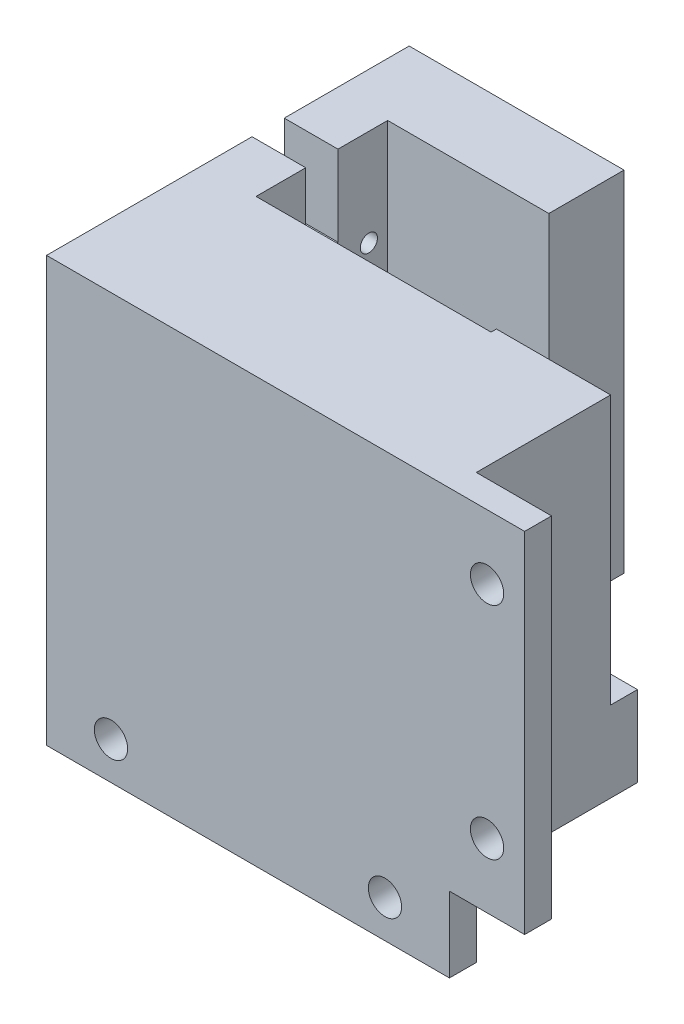
from build123d import *
from build123d.topology import SkipClean

# Parameters (mm, degrees)
BOSS_EXTRUDE1_DEPTH      = 42.5
BOSS_EXTRUDE1_DEPTH_BACK = 15
SKETCH1_W                = 40
SKETCH1_H                = 65
SKETCH3_W                = 22.5
SKETCH3_H                = 50
CUT_EXTRUDE2_DEPTH       = 30
SKETCH4_R                = 4.5
CUT_EXTRUDE3_DEPTH       = 10
SKETCH5_W                = 35
SKETCH5_H                = 25
BOSS_EXTRUDE3_DEPTH      = 15
SKETCH6_R                = 3
CUT_EXTRUDE4_DEPTH       = 30
CUT_EXTRUDE5_DEPTH       = 108.964114408
BOSS_EXTRUDE4_DEPTH      = 10
BOSS_EXTRUDE5_OUTLINE_R  = 3
BOSS_EXTRUDE5_DEPTH      = 50
BOSS_EXTRUDE6_START      = -35
SKETCH11_R               = 3
BOSS_EXTRUDE6_DEPTH      = 35
SKETCH12_W               = 14
SKETCH12_H               = 65
SKETCH12_R               = 3.1
SKETCH12_W_2             = 75
SKETCH12_H_2             = 14
BOSS_EXTRUDE7_DEPTH      = 5
SKETCH13_R               = 1.6
CUT_EXTRUDE6_DEPTH       = 115.988042857
CUT_EXTRUDE7_DEPTH       = 12.25
CUT_EXTRUDE7_DEPTH_BACK  = 12.25
SKETCH14_W               = 43.75
SKETCH14_H               = 50
CUT_EXTRUDE8_DEPTH       = 30
CUT_EXTRUDE9_DEPTH       = 115.988042857


# Read off the part's stored shape, not the designer's step: Boss-Extrude5
with BuildPart() as part:
    # Sketch1 → Boss-Extrude1 (new, two sides: drawn at the far end of the back side and taken through both)
    with BuildSketch(Plane.XY.offset(-BOSS_EXTRUDE1_DEPTH_BACK)):
        with Locations((20, 32.5)):
            Rectangle(SKETCH1_W, SKETCH1_H)
    extrude(amount=BOSS_EXTRUDE1_DEPTH + BOSS_EXTRUDE1_DEPTH_BACK)

    # Sketch3 → Cut-Extrude2 (cut)
    with BuildSketch(Plane(origin=(40, 0, 0), x_dir=(0, 0, -1), z_dir=(1, 0, 0))):
        with Locations((-11.25, 40)):
            Rectangle(SKETCH3_W, SKETCH3_H)
    extrude(amount=-CUT_EXTRUDE2_DEPTH, mode=Mode.SUBTRACT)

    # Sketch4 → Cut-Extrude3 (cut)
    with BuildSketch(Plane(origin=(10, 0, 0), x_dir=(0, 0, -1), z_dir=(1, 0, 0))):
        with Locations((-11.25, 26.5)):
            Circle(SKETCH4_R)
    extrude(amount=-CUT_EXTRUDE3_DEPTH, mode=Mode.SUBTRACT)

    # Sketch5 → Boss-Extrude3 (add)
    with BuildSketch(Plane.XZ):
        with Locations((57.5, 30)):
            Rectangle(SKETCH5_W, SKETCH5_H)
    extrude(amount=-BOSS_EXTRUDE3_DEPTH)

    # Sketch6 → Cut-Extrude4 (cut)
    with BuildSketch(Plane.XZ):
        with Locations(Location((32, 29.5, 0), (0, 0, 270))):
            Circle(SKETCH6_R)
        with Locations(Location((64, 29.5, 0), (0, 0, 270))):
            Circle(SKETCH6_R)
    extrude(amount=-CUT_EXTRUDE4_DEPTH, mode=Mode.SUBTRACT)

    # Sketch8 → Cut-Extrude5 (cut, through all)
    with BuildSketch(Plane.XZ):
        Polygon((48.25, 17.5), (42.75, 17.5), (42.75, 23), (53.75, 23), (53.75, 17.5), align=None)
    extrude(amount=-CUT_EXTRUDE5_DEPTH, mode=Mode.SUBTRACT)

    # Sketch9 → Boss-Extrude4 (add)
    with BuildSketch(Plane.XY.offset(42.5)):
        Polygon((0, 65), (0, 0), (75, 0), (75, 15), (40, 15), (40, 65), align=None)
    extrude(amount=BOSS_EXTRUDE4_DEPTH)

    # Boss-Extrude5 outline → Boss-Extrude5 (add)
    with SkipClean():  # the faces are left unmerged after this step: merging them gives an invalid solid
        with BuildSketch(Plane(origin=(0, 15, 0), x_dir=(1, 0, 0), z_dir=(0, 1, 0))):
            Polygon((75, -52.5), (75, -22.5), (53.75, -22.5), (53.75, -23), (42.75, -23), (42.75, -22.5), (40, -22.5), (40, -52.5), align=None)
            with Locations((64, -29.5)):
                Circle(BOSS_EXTRUDE5_OUTLINE_R, mode=Mode.SUBTRACT)
        extrude(amount=BOSS_EXTRUDE5_DEPTH)

    # Sketch11 → Boss-Extrude6 (add)
    with SkipClean():  # the faces are left unmerged after this step: merging them gives an invalid solid
        with BuildSketch(Plane(origin=(0, 65, 0), x_dir=(1, 0, 0), z_dir=(0, 1, 0)).offset(BOSS_EXTRUDE6_START)):
            with Locations(Location((64, -29.5, 0), (0, 0, 90))):
                Circle(SKETCH11_R)
        extrude(amount=BOSS_EXTRUDE6_DEPTH)

    # Sketch12 → Boss-Extrude7 (add)
    # profile 1 of 2: a face of its own
    with SkipClean():  # the faces are left unmerged after this step: merging them gives an invalid solid
        with BuildSketch(Plane.XY.offset(52.5)):
            with Locations((82, 32.5)):
                Rectangle(SKETCH12_W, SKETCH12_H)
            with Locations((82, 53)):
                Circle(SKETCH12_R, mode=Mode.SUBTRACT)
            with Locations((82, 12)):
                Circle(SKETCH12_R, mode=Mode.SUBTRACT)
        # profile 2 of 2: a face of its own
        with BuildSketch(Plane.XY.offset(52.5)):
            with Locations((37.5, -7)):
                Rectangle(SKETCH12_W_2, SKETCH12_H_2)
            with Locations((12, -7)):
                Circle(SKETCH12_R, mode=Mode.SUBTRACT)
            with Locations((63, -7)):
                Circle(SKETCH12_R, mode=Mode.SUBTRACT)
        extrude(amount=-BOSS_EXTRUDE7_DEPTH)

    # Sketch13 → Cut-Extrude6 (cut, through all)
    with SkipClean():  # the faces are left unmerged after this step: merging them gives an invalid solid
        with BuildSketch(Plane(origin=(10, 0, 0), x_dir=(0, 0, -1), z_dir=(1, 0, 0))):
            with Locations((-2.5, 47)):
                Circle(SKETCH13_R)
            with Locations((-20, 47)):
                Circle(SKETCH13_R)
        extrude(amount=-CUT_EXTRUDE6_DEPTH, mode=Mode.SUBTRACT)

    # Sketch14 → Cut-Extrude7 (cut, two sides: drawn at the far end of the back side and taken through both)
    with SkipClean():  # the faces are left unmerged after this step: merging them gives an invalid solid
        with BuildSketch(Plane(origin=(0, 0, 11.25), x_dir=(-1, 0, 0), z_dir=(0, 0, -1)).offset(-CUT_EXTRUDE7_DEPTH_BACK)):
            with Locations((-31.875, 40)):
                Rectangle(SKETCH14_W, SKETCH14_H)
        extrude(amount=CUT_EXTRUDE7_DEPTH + CUT_EXTRUDE7_DEPTH_BACK, mode=Mode.SUBTRACT)

    # Sketch15 → Cut-Extrude8 (cut)
    with SkipClean():  # the faces are left unmerged after this step: merging them gives an invalid solid
        with BuildSketch(Plane(origin=(40, 0, 0), x_dir=(0, 0, -1), z_dir=(1, 0, 0))):
            Polygon((-11.25, 15), (-8.25, 15), (-8.25, 9), (-14.25, 9), (-14.25, 15), align=None)
        extrude(amount=-CUT_EXTRUDE8_DEPTH, mode=Mode.SUBTRACT)

    # Sketch16 → Cut-Extrude9 (cut, through all)
    with SkipClean():  # the faces are left unmerged after this step: merging them gives an invalid solid
        with BuildSketch(Plane(origin=(10, 0, 0), x_dir=(0, 0, -1), z_dir=(1, 0, 0))):
            Polygon((-11.25, 65), (-8.25, 65), (-8.25, 50), (-14.25, 50), (-14.25, 65), align=None)
        extrude(amount=-CUT_EXTRUDE9_DEPTH, mode=Mode.SUBTRACT)


solid = part.part
